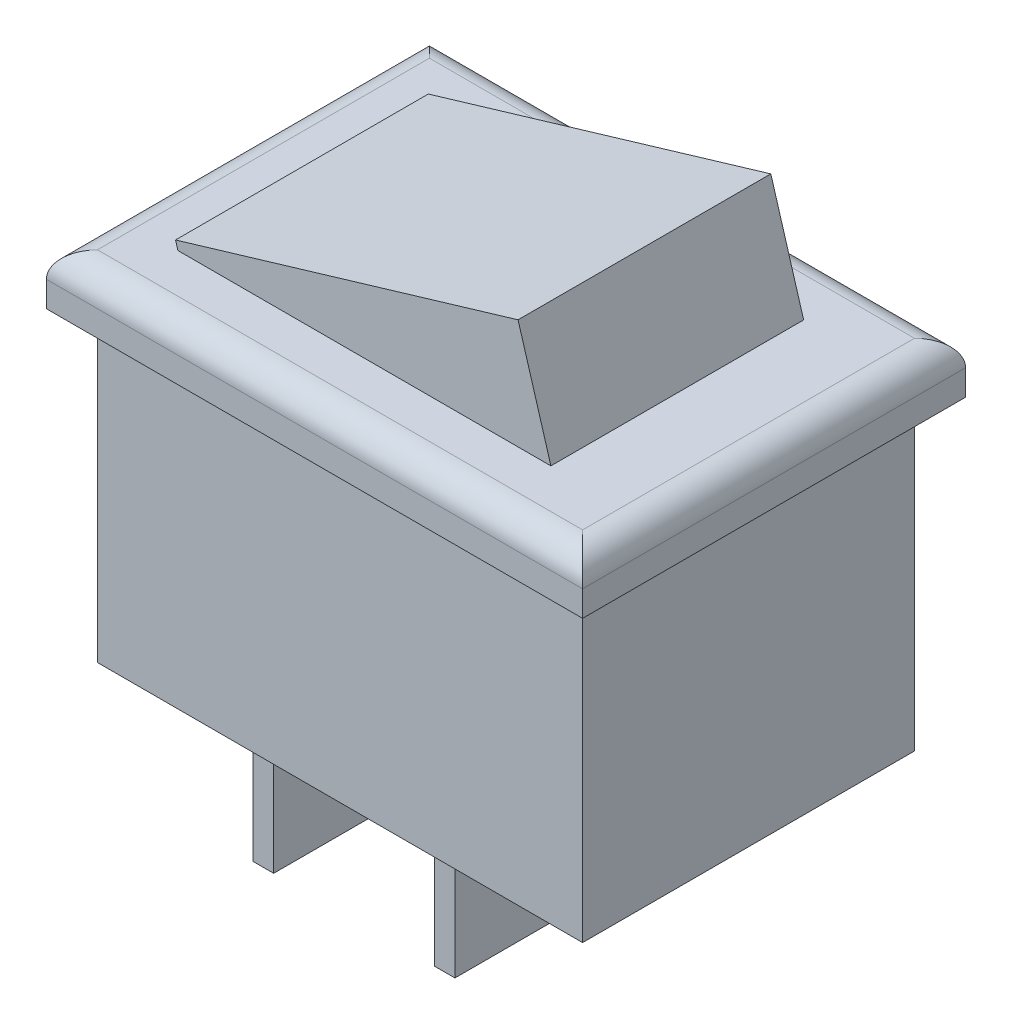
from build123d import *

# Parameters (mm, degrees)
ESQUISSE1_W          = 21
ESQUISSE1_H          = 15
BOSS_EXTRU_1_DEPTH   = 2
ESQUISSE2_W          = 19
ESQUISSE2_H          = 13
BOSS_EXTRU_2_DEPTH   = 14
ESQUISSE3_W          = 0.8
ESQUISSE3_H          = 4.8
BOSS_EXTRU_3_DEPTH   = 7.8
BOSS_EXTRU_3_2_DEPTH = 7.8
CONG_1_R             = 1
BOSS_EXTRU_4_DEPTH   = 4.95


with BuildPart() as part:
    # Esquisse1 → Boss.-Extru.1 (new body)
    with BuildSketch(Plane(origin=(0, 0, 0), x_dir=(1, 0, 0), z_dir=(0, 1, 0))):
        Rectangle(ESQUISSE1_W, ESQUISSE1_H)
    extrude(amount=BOSS_EXTRU_1_DEPTH)

    # Esquisse2 → Boss.-Extru.2 (add)
    with BuildSketch(Plane(origin=(0, 2, 0), x_dir=(1, 0, 0), z_dir=(0, 1, 0))):
        Rectangle(ESQUISSE2_W, ESQUISSE2_H)
    extrude(amount=-BOSS_EXTRU_2_DEPTH)

    # Congé1
    cong_1_edges = [part.edges().sort_by_distance(p)[0] for p in [
        (0, 2, 7.5),
        (-10.5, 2, 0),
        (0, 2, -7.5),
        (10.5, 2, 0),
    ]]
    fillet(cong_1_edges, radius=CONG_1_R)

    # Esquisse4 → Boss.-Extru.4 (add, symmetric)
    with BuildSketch(Plane.XY):
        Polygon((-7.993918218, 2.312416814), (-6.708203932, -2), (6.708203932, 2), (5.422489647, 6.312416814), align=None)
    extrude(amount=BOSS_EXTRU_4_DEPTH, both=True)


with BuildPart() as body_2:
    # Esquisse3 → Boss.-Extru.3 (new body)
    with BuildSketch(Plane.XZ.offset(12)):
        with Locations((-7.1, 0)):
            Rectangle(ESQUISSE3_W, ESQUISSE3_H)
    extrude(amount=BOSS_EXTRU_3_DEPTH)


with BuildPart() as body_3:
    # Esquisse3 → Boss.-Extru.3 2 (new body)
    with BuildSketch(Plane.XZ.offset(12)):
        Rectangle(ESQUISSE3_W, ESQUISSE3_H)
    extrude(amount=BOSS_EXTRU_3_2_DEPTH)


solid = Compound([part.part, body_2.part, body_3.part])
